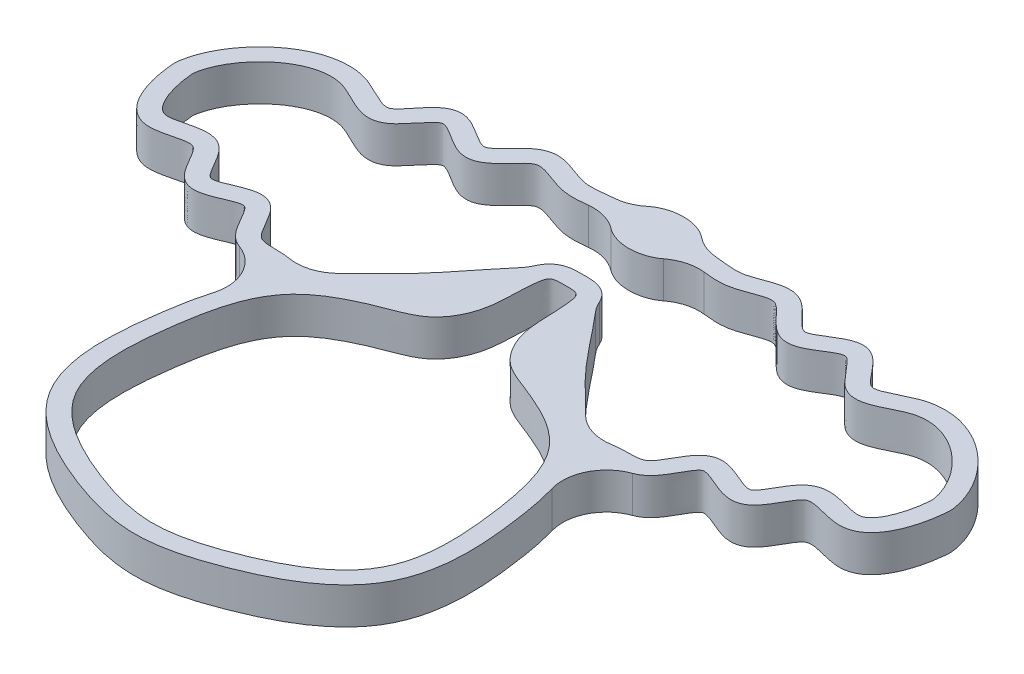
from build123d import *
from build123d.topology import SkipClean

# Parameters (mm, degrees)
BOSS_EXTRUDE1_DEPTH = 10
BOSS_EXTRUDE2_DEPTH = 10
BOSS_EXTRUDE3_REACH = 151.119
SKETCH5_W           = 5
SKETCH5_H           = 10
SKETCH6_RX          = 10
SKETCH6_RY          = 7.5
BOSS_EXTRUDE4_DEPTH = 10
CUT_EXTRUDE1_DEPTH  = 10
FILLET1_R           = 12


# Read off the part's stored shape, not the designer's step: Boss-Extrude1, Cut-Extrude1
with BuildPart() as part:
    # Boss-Extrude1 outline → Boss-Extrude1 (new body)
    with BuildSketch(Plane(origin=(0, 0, 0), x_dir=(1, 0, 0), z_dir=(0, 1, 0))):
        with BuildLine():
            add(Edge.make_bspline(
                [(0, 68), (-0.229955016, 68), (-0.689865049, 68.004974728), (-1.591414553, 68.002520989), (-2.663266621, 67.942332713), (-3.975675477, 67.733039222), (-5.328232552, 67.264665196), (-6.494121542, 66.549259145), (-7.346603188, 65.813842008), (-8.071785617, 64.907860236), (-8.702261378, 63.789000687), (-9.114098701, 62.590139977), (-9.346552866, 61.453066474), (-9.466907202, 60.596563457), (-9.560505535, 59.844888938), (-9.667772758, 58.831893117), (-9.766560612, 57.615782215), (-9.845951195, 56.216546964), (-9.90010575, 54.884121927), (-9.956888501, 53.194703593), (-10.030517689, 51.246803133), (-10.206000698, 49.158632524), (-10.524781985, 47.290194827), (-11.042323658, 45.551143123), (-11.8274076, 43.808085659), (-12.810187918, 42.261131322), (-13.738158049, 41.226169627), (-14.474995423, 40.606305144), (-15.343997305, 40.00496245), (-16.706020449, 39.2810116), (-18.761879479, 38.43451401), (-21.209735443, 37.516956832), (-23.750098329, 36.499006083), (-27.137875042, 35.028743538), (-31.346117134, 32.908554215), (-35.331632412, 30.249788348), (-38.25092656, 27.686652161), (-40.938574749, 24.766384761), (-43.57436943, 20.702748431), (-45.80484171, 15.458780742), (-47.348387511, 10.010298069), (-48.419992465, 4.454868396), (-49.217209103, -1.048797751), (-49.856507687, -6.67454438), (-50.167942636, -12.36440955), (-50.005406991, -18.04347673), (-49.19091454, -23.646379545), (-47.793096305, -28.178380739), (-46.133686884, -31.642292326), (-44.075306846, -34.949636813), (-40.934218174, -38.562379143), (-36.531759568, -42.206534709), (-31.702967125, -45.273678326), (-26.614712032, -47.873585483), (-21.421784466, -50.08078529), (-16.288403945, -51.989197765), (-11.013101748, -53.596173502), (-5.608553423, -54.70769409), (0, -55.146152955), (5.608553423, -54.70769409), (11.013101748, -53.596173502), (16.288403945, -51.989197765), (21.421784466, -50.08078529), (26.614712032, -47.873585483), (31.702967125, -45.273678326), (36.531759568, -42.206534709), (40.934218174, -38.562379143), (44.075306846, -34.949636813), (46.133686884, -31.642292326), (47.793096305, -28.178380739), (49.19091454, -23.646379545), (50.005406991, -18.04347673), (50.167942636, -12.36440955), (49.856507687, -6.67454438), (49.217209103, -1.048797751), (48.419992465, 4.454868396), (47.348387511, 10.010298069), (45.80484171, 15.458780742), (43.57436943, 20.702748431), (40.938574749, 24.766384761), (38.25092656, 27.686652161), (35.331632412, 30.249788348), (31.346117134, 32.908554215), (27.137875042, 35.028743538), (23.750098329, 36.499006083), (21.209735443, 37.516956832), (18.761879479, 38.43451401), (16.706020449, 39.2810116), (15.343997305, 40.00496245), (14.474995423, 40.606305144), (13.738158049, 41.226169627), (12.810187918, 42.261131322), (11.8274076, 43.808085659), (11.042323658, 45.551143123), (10.524781985, 47.290194827), (10.206000698, 49.158632524), (10.030517689, 51.246803133), (9.956888501, 53.194703593), (9.90010575, 54.884121927), (9.845951195, 56.216546964), (9.766560612, 57.615782215), (9.667772758, 58.831893117), (9.560505535, 59.844888938), (9.466907202, 60.596563457), (9.346552866, 61.453066474), (9.114098701, 62.590139977), (8.702261378, 63.789000687), (8.071785617, 64.907860236), (7.346603188, 65.813842008), (6.494121542, 66.549259145), (5.328232552, 67.264665196), (3.975675477, 67.733039222), (2.663266621, 67.942332713), (1.591414553, 68.002520989), (0.689865049, 68.004974728), (0.229955016, 68), (0, 68)],
                knots=[0, 0, 0, 0, 0.001953125, 0.00390625, 0.005859375, 0.0078125, 0.009765625, 0.010742188, 0.01171875, 0.012695312, 0.013671875, 0.015625, 0.017578125, 0.01953125, 0.021484375, 0.0234375, 0.02734375, 0.03125, 0.03515625, 0.0390625, 0.046875, 0.0546875, 0.0625, 0.0703125, 0.078125, 0.0859375, 0.09375, 0.09765625, 0.1015625, 0.109375, 0.1171875, 0.125, 0.1328125, 0.140625, 0.15625, 0.171875, 0.1796875, 0.1875, 0.203125, 0.21875, 0.234375, 0.25, 0.265625, 0.28125, 0.296875, 0.3125, 0.328125, 0.34375, 0.3515625, 0.359375, 0.375, 0.390625, 0.40625, 0.421875, 0.4375, 0.453125, 0.46875, 0.484375, 0.5, 0.515625, 0.53125, 0.546875, 0.5625, 0.578125, 0.59375, 0.609375, 0.625, 0.640625, 0.6484375, 0.65625, 0.671875, 0.6875, 0.703125, 0.71875, 0.734375, 0.75, 0.765625, 0.78125, 0.796875, 0.8125, 0.8203125, 0.828125, 0.84375, 0.859375, 0.8671875, 0.875, 0.8828125, 0.890625, 0.8984375, 0.90234375, 0.90625, 0.9140625, 0.921875, 0.9296875, 0.9375, 0.9453125, 0.953125, 0.9609375, 0.96484375, 0.96875, 0.97265625, 0.9765625, 0.978515625, 0.98046875, 0.982421875, 0.984375, 0.986328125, 0.987304688, 0.98828125, 0.989257812, 0.990234375, 0.9921875, 0.994140625, 0.99609375, 0.998046875, 1, 1, 1, 1], degree=3))
        make_face()
        with BuildLine():
            add(Edge.make_bspline(
                [(0, 63), (-1.52652089, 63), (-3.986940007, 63.159481514), (-5.346196174, 55.274620078), (-4.149353373, 46.810195668), (-10.242716569, 36.151969235), (-22.370270069, 31.936434422), (-39.510854167, 23.948082796), (-45.007896798, -1.712817306), (-46.722154478, -32.350862611), (-21.102343681, -45.688135745), (0, -51.703869298), (21.102343681, -45.688135745), (46.722154478, -32.350862611), (45.007896798, -1.712817306), (39.510854167, 23.948082796), (22.370270069, 31.936434422), (10.242716569, 36.151969235), (4.149353373, 46.810195668), (5.346196174, 55.274620078), (3.986940007, 63.159481514), (1.52652089, 63), (0, 63)],
                knots=[0, 0, 0, 0, 0.012028603, 0.019387488, 0.066377658, 0.095784615, 0.123665083, 0.184474112, 0.260640782, 0.354546782, 0.442522942, 0.5, 0.557477058, 0.645453218, 0.739359218, 0.815525888, 0.876334917, 0.904215385, 0.933622342, 0.980612512, 0.987971397, 1, 1, 1, 1], degree=3))
        make_face(mode=Mode.SUBTRACT)
    extrude(amount=BOSS_EXTRUDE1_DEPTH)

    # Sketch4 → Boss-Extrude2 (add)
    with BuildSketch(Plane(origin=(0, 0, 0), x_dir=(1, 0, 0), z_dir=(0, 1, 0))):
        with BuildLine():
            Line((10, 85.5), (10, 90.5))
            add(Edge.make_bspline(
                [(39.280273452, 22.807206451), (39.435348217, 22.946220579), (39.734847022, 23.202941235), (40.483674426, 23.813317096), (41.562260278, 24.659890657), (42.741375958, 25.612361398), (43.697773472, 26.237291042), (44.48305582, 26.54738705), (45.632763972, 26.763149097), (47.023237122, 26.847573935), (48.604444255, 26.867638136), (50.320105099, 26.910827905), (52.144109021, 27.096051165), (53.740737861, 27.508845191), (55.016206296, 28.098385679), (56.251125676, 28.903236135), (57.470097523, 30.11446412), (58.997856372, 32.216032954), (60.160569751, 34.367201598), (61.21283553, 36.15862307), (61.94612514, 37.192435189), (62.454929683, 37.682305652), (62.730268087, 37.85317647), (62.856356947, 37.903594015), (62.989558952, 37.932679682), (63.375610602, 37.948337048), (64.182731868, 37.816800788), (65.504775626, 37.373019327), (67.032952424, 36.736172549), (68.693598227, 36.022616876), (70.45440097, 35.353263718), (72.336653414, 34.863483084), (74.073988734, 34.767609854), (75.589817253, 35.104992595), (76.975850217, 35.743401221), (78.3008173, 36.857270748), (79.486373338, 38.364671937), (80.464342756, 39.934714384), (81.337386889, 41.479309221), (82.159888932, 42.891835576), (82.949993435, 44.046779555), (83.545116048, 44.678026254), (83.928977576, 44.958354742), (84.217257325, 45.108578265), (84.735240545, 45.249414768), (85.740715644, 45.256827323), (87.486689679, 44.99520737), (89.630735903, 44.419101284), (91.972039828, 43.886779746), (93.822008313, 43.625014607), (95.812411634, 43.644617836), (97.83870088, 44.203088282), (99.546148998, 45.201596462), (101.454178334, 46.931006927), (103.224206985, 49.593321921), (104.454810161, 52.604826783), (105.188598666, 55.090980456), (105.624107342, 56.956583878), (105.898639361, 58.484723837), (106.068974901, 59.667019721), (106.171993249, 60.544790433), (106.254294841, 61.345856296), (106.307579984, 62.388596241), (106.217524124, 63.437691284), (106.052414138, 64.366742588), (105.85540992, 65.223851422), (105.540894257, 66.376545726), (104.863254585, 68.367951035), (103.556541101, 71.146086396), (100.839018007, 75.360353066), (96.421021399, 80.04345919), (90.984914639, 83.46874636), (86.202689905, 85.098101011), (82.447607404, 85.651227466), (79.252044838, 85.455396455), (76.690988769, 84.842912929), (74.231028635, 83.935366222), (71.498772596, 82.561533259), (69.147477889, 81.422945465), (67.651392623, 80.943636255), (66.79445913, 80.828220546), (66.246973211, 80.897516833), (65.789859023, 81.087124998), (64.963114708, 81.723933381), (64.012209832, 82.737506316), (62.975748545, 84.002125963), (61.869100297, 85.391357721), (60.661507591, 86.794057862), (59.284934992, 88.109262535), (57.866520513, 89.034402156), (56.48522669, 89.524199755), (54.935859095, 89.741334334), (53.179514796, 89.459784602), (51.379012627, 88.729785243), (49.743846551, 87.816863771), (48.217679339, 86.853299161), (46.797361339, 85.960116386), (45.522856106, 85.259500187), (44.663496237, 84.932175502), (44.172137183, 84.835224242), (43.92035974, 84.825585752), (43.744343348, 84.848968752), (43.398174794, 84.951324471), (42.779048317, 85.288744384), (41.823191722, 86.081540908), (40.754594295, 87.163426259), (39.598126382, 88.415727791), (38.342811165, 89.72637579), (36.935458408, 90.986609417), (35.290439471, 92.094606402), (33.210270551, 92.796543284), (31.209783207, 92.854793974), (29.364929637, 92.55464646), (27.078234395, 91.883774334), (24.977685604, 91.049565165), (23.052193866, 90.395275148), (21.764887311, 90.070058726), (20.543796607, 89.931218186), (19.225816322, 89.921207214), (17.83862311, 90.016652968), (16.369278114, 90.176642086), (14.82736942, 90.352754115), (13.179836121, 90.489822868), (11.53006482, 90.511693513), (10.517279622, 90.5), (10, 90.5)],
                knots=[0, 0, 0, 0, 0.00390625, 0.0078125, 0.015625, 0.0234375, 0.03125, 0.0390625, 0.046875, 0.0546875, 0.0625, 0.0703125, 0.078125, 0.0859375, 0.08984375, 0.09375, 0.1015625, 0.109375, 0.125, 0.1328125, 0.140625, 0.1484375, 0.15234375, 0.15625, 0.16015625, 0.1640625, 0.171875, 0.1796875, 0.1875, 0.1953125, 0.203125, 0.2109375, 0.21875, 0.22265625, 0.2265625, 0.234375, 0.2421875, 0.25, 0.2578125, 0.265625, 0.2734375, 0.28125, 0.28515625, 0.2890625, 0.296875, 0.3046875, 0.3125, 0.328125, 0.3359375, 0.34375, 0.3515625, 0.359375, 0.3671875, 0.375, 0.390625, 0.40625, 0.4140625, 0.421875, 0.4296875, 0.43359375, 0.4375, 0.44140625, 0.4453125, 0.44921875, 0.453125, 0.45703125, 0.4609375, 0.46875, 0.484375, 0.5, 0.53125, 0.5625, 0.578125, 0.59375, 0.609375, 0.6171875, 0.625, 0.640625, 0.65625, 0.6640625, 0.671875, 0.6796875, 0.6875, 0.6953125, 0.703125, 0.7109375, 0.71875, 0.7265625, 0.734375, 0.7421875, 0.74609375, 0.75, 0.7578125, 0.765625, 0.7734375, 0.78125, 0.7890625, 0.796875, 0.8046875, 0.80859375, 0.8125, 0.81640625, 0.8203125, 0.828125, 0.8359375, 0.84375, 0.8515625, 0.859375, 0.8671875, 0.875, 0.8828125, 0.890625, 0.8984375, 0.90625, 0.921875, 0.9296875, 0.9375, 0.9453125, 0.953125, 0.9609375, 0.96875, 0.9765625, 0.984375, 0.9921875, 1, 1, 1, 1], degree=3))
            Line((39.280273452, 22.807206451), (35.942793549, 26.530273452))
            add(Edge.make_bspline(
                [(35.942793549, 26.530273452), (36.342094806, 26.888220253), (37.175635233, 27.572784014), (38.421953636, 28.550574246), (39.68552919, 29.572039953), (41.24165139, 30.641980436), (43.227659482, 31.429886216), (45.109846802, 31.741954801), (46.899001522, 31.848343056), (48.559189189, 31.866842167), (50.053473663, 31.907791249), (51.316845777, 32.046263308), (52.114009816, 32.266429881), (52.601258431, 32.496619228), (53.009144231, 32.759856791), (53.622252901, 33.338266293), (54.680217329, 34.76982986), (55.760456699, 36.739091071), (56.966004512, 38.80656411), (58.022678455, 40.324469226), (59.160354557, 41.499200679), (60.339868656, 42.2766386), (61.384560411, 42.720175784), (62.514363806, 42.937643127), (63.923597452, 42.953348072), (65.540545437, 42.64470007), (67.328176626, 42.031677518), (69.022693762, 41.322985186), (70.610505198, 40.641461595), (72.035223089, 40.106590448), (73.192114504, 39.819249032), (73.897044302, 39.835915509), (74.070726186, 39.897381786), (74.629337343, 40.296786385), (75.350961905, 41.191859934), (76.140877235, 42.447839856), (76.978064266, 43.927642986), (77.895296875, 45.507883469), (78.9599813, 47.085700196), (80.078445626, 48.323359644), (81.208424382, 49.180654333), (82.546212618, 49.884802565), (84.27316669, 50.274565068), (86.221249899, 50.249875276), (88.662118101, 49.866167717), (90.928161398, 49.248008195), (92.922316538, 48.800886758), (94.211629959, 48.628127791), (95.175341525, 48.659613905), (95.837095194, 48.850127134), (96.549766246, 49.248278545), (97.526921175, 50.117726396), (98.743383238, 51.875895559), (99.732552615, 54.272700565), (100.350095261, 56.362241367), (100.724910213, 57.966842971), (100.96330096, 59.291140802), (101.111401333, 60.323677839), (101.199706429, 61.063960324), (101.273200049, 61.822100204), (101.294575407, 62.290736757), (101.256543974, 62.757595357), (101.156028285, 63.345652148), (101.003658875, 64.00989376), (100.763646557, 64.888979402), (100.38449016, 66.006011628), (99.811193651, 67.351790672), (98.895789295, 69.139959043), (97.485707812, 71.330024737), (95.429366337, 73.789187843), (92.294139024, 76.721742972), (87.814241633, 79.521147171), (83.128719998, 80.676393705), (79.482350298, 80.450956171), (76.828872352, 79.635023627), (73.816413906, 78.137549401), (71.180523683, 76.835108627), (68.891320065, 76.078009985), (67.025384608, 75.782212484), (64.977792668, 75.960512293), (62.986413605, 76.872719774), (61.493103811, 78.111814658), (60.209602355, 79.484185784), (59.060180032, 80.893790143), (57.990828547, 82.23399874), (56.9940554, 83.385816733), (56.099604431, 84.219672034), (55.537856119, 84.554307694), (55.263642534, 84.640599519), (55.102272002, 84.665514081), (54.616988679, 84.627306245), (53.603839326, 84.239473685), (52.33972738, 83.541301957), (50.919962652, 82.64693344), (49.386422245, 81.68025132), (47.737949868, 80.764471992), (46.219506677, 80.151810231), (44.862905165, 79.864120381), (43.760487703, 79.798287463), (42.619799866, 79.948470162), (41.256682143, 80.38750967), (39.813920642, 81.232610431), (38.378515936, 82.449312558), (36.681131261, 84.177658315), (35.166086968, 85.863983409), (33.816804593, 87.062074587), (32.949181903, 87.606633857), (32.378424372, 87.789950351), (31.58629005, 87.839605531), (30.525424979, 87.67814635), (28.815890899, 87.187766006), (26.784237015, 86.387386531), (24.533832729, 85.613600427), (22.69048273, 85.141167975), (20.805362293, 84.926835777), (19.039609222, 84.920817252), (17.363427267, 85.03790985), (15.787822786, 85.210916904), (14.300678763, 85.379529845), (12.934725814, 85.49219645), (11.804161731, 85.507807468), (10.806471312, 85.502889439), (10.265298054, 85.5), (10, 85.5)],
                knots=[0, 0, 0, 0, 0.0078125, 0.015625, 0.0234375, 0.03125, 0.0390625, 0.046875, 0.0546875, 0.0625, 0.0703125, 0.078125, 0.0859375, 0.08984375, 0.09375, 0.1015625, 0.109375, 0.125, 0.1328125, 0.140625, 0.1484375, 0.15234375, 0.15625, 0.16015625, 0.1640625, 0.171875, 0.1796875, 0.1875, 0.1953125, 0.203125, 0.2109375, 0.21875, 0.2265625, 0.234375, 0.2421875, 0.25, 0.2578125, 0.265625, 0.2734375, 0.28125, 0.28515625, 0.2890625, 0.296875, 0.3046875, 0.3125, 0.328125, 0.3359375, 0.34375, 0.3515625, 0.359375, 0.3671875, 0.375, 0.390625, 0.40625, 0.4140625, 0.421875, 0.4296875, 0.43359375, 0.4375, 0.44140625, 0.4453125, 0.44921875, 0.453125, 0.45703125, 0.4609375, 0.46875, 0.4765625, 0.484375, 0.5, 0.515625, 0.53125, 0.5625, 0.59375, 0.609375, 0.625, 0.640625, 0.65625, 0.6640625, 0.671875, 0.6796875, 0.6875, 0.6953125, 0.703125, 0.7109375, 0.71875, 0.7265625, 0.734375, 0.7421875, 0.74609375, 0.75, 0.7578125, 0.765625, 0.7734375, 0.78125, 0.7890625, 0.796875, 0.8046875, 0.80859375, 0.8125, 0.81640625, 0.8203125, 0.828125, 0.8359375, 0.84375, 0.859375, 0.8671875, 0.875, 0.8828125, 0.890625, 0.8984375, 0.90625, 0.921875, 0.9296875, 0.9375, 0.9453125, 0.953125, 0.9609375, 0.96875, 0.9765625, 0.984375, 0.9921875, 0.99609375, 1, 1, 1, 1], degree=3))
        make_face()
    boss_extrude2 = extrude(amount=BOSS_EXTRUDE2_DEPTH)

    # Mirror1: Boss-Extrude2 across plane
    with SkipClean():  # the faces are left unmerged after this step: merging them gives an invalid solid
        add(boss_extrude2.mirror(Plane(origin=(0, 0, 0), x_dir=(0, 0, 1), z_dir=(1, 0, 0))))
    add(part.part.scale(1), mode=Mode.REPLACE)  # the faces are merged on a copy

    # Boss-Extrude3: up to this face of the body (flat: up to its plane)
    boss_extrude3_end = Plane(part.part.faces().sort_by_distance((10, 5, -88))[0])
    # Sketch5 → Boss-Extrude3 (add, up to the picked face)
    with BuildSketch(Plane(origin=(-10, 0, 0), x_dir=(0, 0, -1), z_dir=(1, 0, 0)), mode=Mode.PRIVATE) as boss_extrude3_sk1:
        with Locations((88, 5)):
            Rectangle(SKETCH5_W, SKETCH5_H)
    boss_extrude3_tool1 = split(extrude(boss_extrude3_sk1.sketch, amount=BOSS_EXTRUDE3_REACH, mode=Mode.PRIVATE), bisect_by=boss_extrude3_end, keep=Keep.BOTH, mode=Mode.PRIVATE)
    add(boss_extrude3_tool1.solids().sort_by(Axis((-10, 5, -88), (1, 0, 0)))[0])

    # Sketch6 → Boss-Extrude4 (add)
    with BuildSketch(Plane(origin=(0, 0, 0), x_dir=(1, 0, 0), z_dir=(0, 1, 0))):
        with Locations(Location((0, 88), (0, 0, 180))):
            Ellipse(SKETCH6_RX, SKETCH6_RY)
        with BuildLine():
            add(Edge.make_bspline(
                [(-41.071615172, 24.375831098), (-40.808288357, 29.591021177), (-19.918389257, 44.979141392), (0, 80.652886558), (19.918389257, 44.979141392), (69.414690824, 8.518695361), (-41.872278039, 8.518695361), (-41.071615172, 24.375831098)],
                knots=[0, 0, 0, 0, 0.133666052, 0.296789696, 0.459913341, 0.593579392, 1, 1, 1, 1], degree=3))
        make_face()
    extrude(amount=BOSS_EXTRUDE4_DEPTH)

    # Cut-Extrude1 outline → Cut-Extrude1 (cut)
    with BuildSketch(Plane(origin=(0, 0, 0), x_dir=(1, 0, 0), z_dir=(0, 1, 0))):
        with BuildLine():
            add(Edge.make_bspline(
                [(38.284681232, 19.559646602), (37.541925284, 20.785488281), (33.040169176, 26.963738894), (22.370270069, 31.936434422), (10.242716569, 36.151969235), (4.149353373, 46.810195668), (5.346196174, 55.274620078), (3.986940007, 63.159481514), (0, 62.901052686), (-3.986940007, 63.159481514), (-5.346196174, 55.274620078), (-4.149353373, 46.810195668), (-10.242716569, 36.151969235), (-22.370270069, 31.936434422), (-33.040169176, 26.963738894), (-37.541925284, 20.785488281), (-38.284681232, 19.559646602)],
                knots=[0.801593522, 0.801593522, 0.801593522, 0.801593522, 0.815525888, 0.876334917, 0.904215385, 0.933622342, 0.980612512, 0.987971397, 1, 1.012028603, 1.019387488, 1.066377658, 1.095784615, 1.123665083, 1.184474112, 1.198406478, 1.198406478, 1.198406478, 1.198406478], degree=3))
            add(Edge.make_bspline(
                [(-38.284681232, 19.559646602), (-25.697022751, 10.124090193), (25.697022748, 10.124090192), (38.284681232, 19.559646602)],
                knots=[0.046456853, 0.046456853, 0.046456853, 0.046456853, 0.359963755, 0.359963755, 0.359963755, 0.359963755], degree=3))
        make_face()
    extrude(amount=CUT_EXTRUDE1_DEPTH, mode=Mode.SUBTRACT)

    # Fillet1
    fillet1_edges = [part.edges().sort_by_distance(p)[0] for p in [
        (9.150957565, 5, -62.33804186),
        (-9.150957565, 5, -62.33804186),
        (-9.428090416, 5, -85.5),
        (9.428090416, 5, -85.5),
        (9.428090416, 5, -90.5),
        (-9.428090416, 5, -90.5),
        (-41.118366446, 5, -24.312480099),
        (41.118366446, 5, -24.312480099),
        (39.024658338, 5, -29.035216155),
        (-39.024658338, 5, -29.035216155),
    ]]
    fillet(fillet1_edges, radius=FILLET1_R)


solid = part.part
